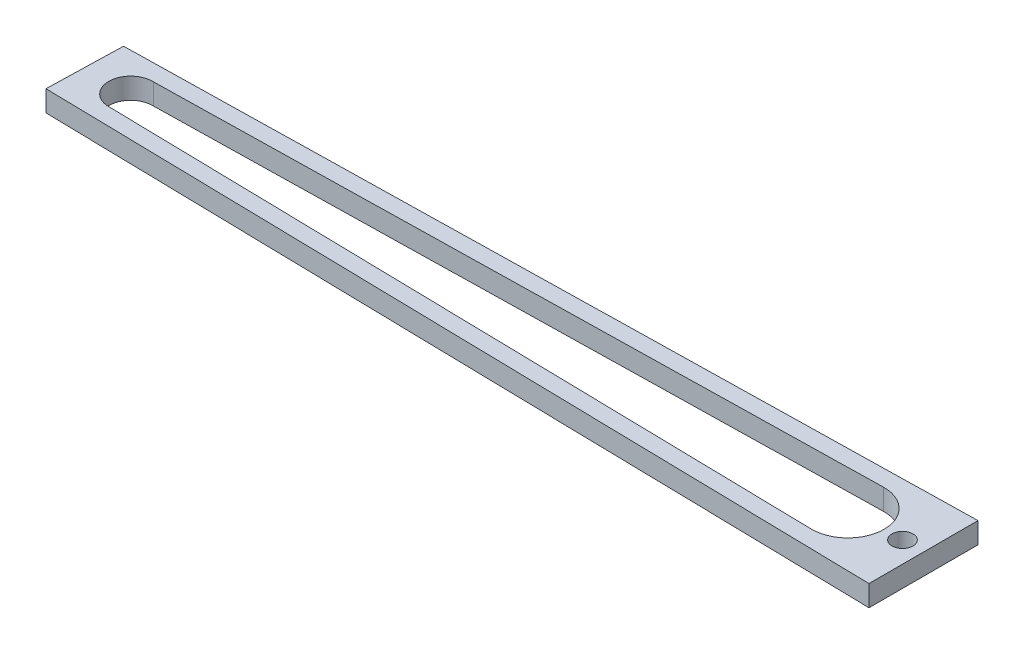
from build123d import *

# Parameters (mm, degrees)
SKETCH1_R           = 2.5
BOSS_EXTRUDE1_DEPTH = 5


with BuildPart() as part:
    # Sketch1 → Boss-Extrude1 (new body)
    with BuildSketch(Plane(origin=(0, 0, 0), x_dir=(1, 0, 0), z_dir=(0, 1, 0))):
        Polygon((-49.807795153, -41.213348306), (-90.005103209, -41.999399148), (-90.480022259, -59.993132832), (109.519977741, -64.056767627), (109.519977741, -38.097723503), align=None)
        with BuildLine():
            Line((-79.112188034, -45.787154937), (91.351489969, -42.453769592))
            ThreePointArc((91.351489969, -42.453769592), (100.137803397, -51.073442227), (91.344504386, -59.685988453))
            Line((91.344504386, -59.685988453), (-79.419326147, -56.217040409))
            ThreePointArc((-79.419326147, -56.217040409), (-84.528615041, -51.150292406), (-79.718159034, -45.799004587))
            ThreePointArc((-79.718159034, -45.799004587), (-79.415345745, -45.784273175), (-79.112188034, -45.787154937))
        make_face(mode=Mode.SUBTRACT)
        with Locations((104.519977741, -51.075218669)):
            Circle(SKETCH1_R, mode=Mode.SUBTRACT)
    extrude(amount=BOSS_EXTRUDE1_DEPTH)


solid = part.part
